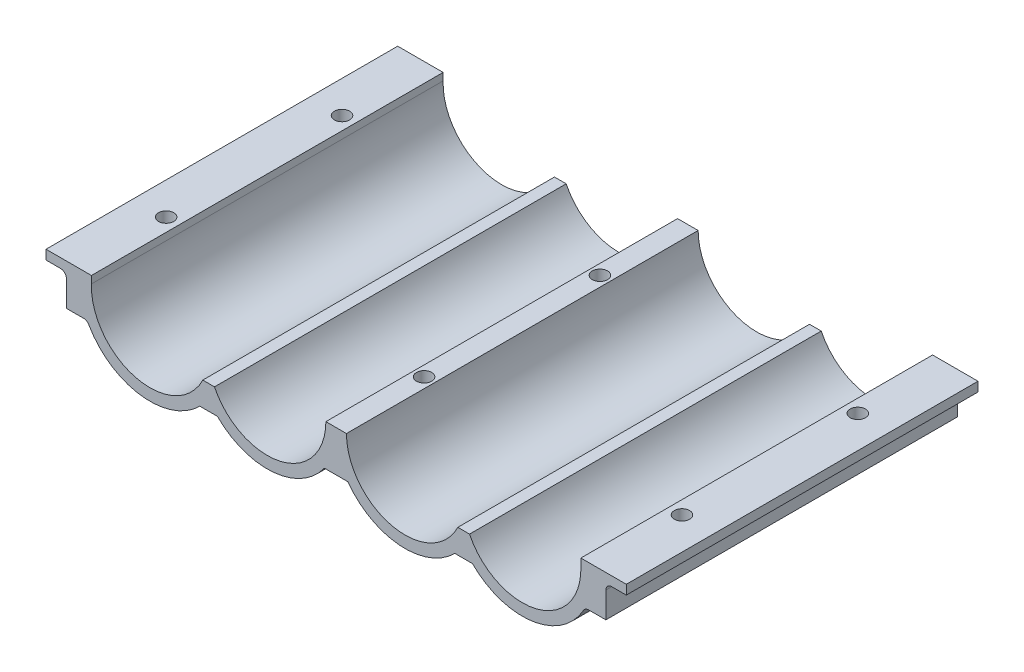
from build123d import *

# Parameters (mm, degrees)
BOSS_EXTRUDE1_DEPTH                  = 60
FILLET1_R                            = 1
F_2_6_START                          = -7
F_2_6_2_6_DIAMETER_HOLE1_OUTLINE_R   = 1.3
F_2_6_2_6_DIAMETER_HOLE1_DEPTH       = 7
F_2_6_START_2                        = -8.6
F_2_6_2_6_DIAMETER_HOLE1_2_OUTLINE_R = 1.3
F_2_6_2_6_DIAMETER_HOLE1_2_DEPTH     = 1.6


# Read off the part's stored shape, not the designer's step: Ø2.6 (2.6) Diameter Hole1
with BuildPart() as part:
    # Sketch1 → Boss-Extrude1 (new body)
    with BuildSketch(Plane.XY):
        with BuildLine():
            Line((0, 0), (7.751531367, 0))
            Line((7.751531367, 0), (7.751531367, -1.25))
            ThreePointArc((7.751531367, -1.25), (15.339084008, -11.30616411), (26.74540449, -5.958898944))
            Line((26.74540449, -5.958898944), (28.74540449, -5.958898944))
            ThreePointArc((28.74540449, -5.958898944), (39.981472468, -11.346794345), (47.74540449, -1.6))
            Line((47.74540449, -1.6), (51.25459551, -1.6))
            ThreePointArc((51.25459551, -1.6), (59.018527532, -11.346794345), (70.25459551, -5.958898944))
            Line((70.25459551, -5.958898944), (72.25459551, -5.958898944))
            ThreePointArc((72.25459551, -5.958898944), (83.660915992, -11.30616411), (91.248468633, -1.25))
            Line((91.248468633, -1.25), (91.248468633, 0))
            Line((91.248468633, 0), (99, 0))
            Line((99, 0), (99, -1.6))
            Line((99, -1.6), (95.52, -1.6))
            Line((95.52, -1.6), (95.52, -7))
            Line((95.52, -7), (91.970938169, -7))
            ThreePointArc((91.970938169, -7), (83.148029778, -13.449679602), (72.75459551, -10.070537173))
            Line((72.75459551, -10.070537173), (69.75459551, -10.070537173))
            ThreePointArc((69.75459551, -10.070537173), (60.290622518, -13.561218837), (51.507801165, -8.6))
            Line((51.507801165, -8.6), (47.492198835, -8.6))
            ThreePointArc((47.492198835, -8.6), (38.709377482, -13.561218837), (29.24540449, -10.070537173))
            Line((29.24540449, -10.070537173), (26.24540449, -10.070537173))
            ThreePointArc((26.24540449, -10.070537173), (15.851970222, -13.449679602), (7.029061831, -7))
            Line((7.029061831, -7), (3.48, -7))
            Line((3.48, -7), (3.48, -1.6))
            Line((3.48, -1.6), (0, -1.6))
            Line((0, -1.6), (0, 0))
        make_face()
    extrude(amount=BOSS_EXTRUDE1_DEPTH)

    # Fillet1
    fillet1_edges = [part.edges().sort_by_distance(p)[0] for p in [
        (95.52, -1.6, 30),
        (91.970938169, -7, 30),
        (7.029061831, -7, 30),
        (3.48, -1.6, 30),
    ]]
    fillet(fillet1_edges, radius=FILLET1_R)

    # Ø2.6 (2.6) Diameter Hole1 outline → Ø2.6 (2.6) Diameter Hole1 (cut)
    with BuildSketch(Plane(origin=(0, 0, 0), x_dir=(1, 0, 0), z_dir=(0, 1, 0)).offset(F_2_6_START)):
        with Locations((93.5, -15)):
            Circle(F_2_6_2_6_DIAMETER_HOLE1_OUTLINE_R)
        with Locations((93.5, -45)):
            Circle(F_2_6_2_6_DIAMETER_HOLE1_OUTLINE_R)
        with Locations((49.5, -15)):
            Circle(F_2_6_2_6_DIAMETER_HOLE1_OUTLINE_R)
        with Locations((49.5, -45)):
            Circle(F_2_6_2_6_DIAMETER_HOLE1_OUTLINE_R)
    f_2_6_2_6_diameter_hole1 = extrude(amount=F_2_6_2_6_DIAMETER_HOLE1_DEPTH, mode=Mode.SUBTRACT)

    # 2.6 _2.6_ Diameter Hole1 2 outline → 2.6 _2.6_ Diameter Hole1 2 (cut)
    with BuildSketch(Plane(origin=(0, 0, 0), x_dir=(1, 0, 0), z_dir=(0, 1, 0)).offset(F_2_6_START_2)):
        with Locations((49.5, -15)):
            Circle(F_2_6_2_6_DIAMETER_HOLE1_2_OUTLINE_R)
        with Locations((49.5, -45)):
            Circle(F_2_6_2_6_DIAMETER_HOLE1_2_OUTLINE_R)
    f_2_6_2_6_diameter_hole1_2 = extrude(amount=F_2_6_2_6_DIAMETER_HOLE1_2_DEPTH, mode=Mode.SUBTRACT)

    # Mirror1: Ø2.6 (2.6) Diameter Hole1, 2.6 _2.6_ Diameter Hole1 2 across plane
    add(f_2_6_2_6_diameter_hole1.mirror(Plane.ZY.offset(-49.5)), mode=Mode.SUBTRACT)
    add(f_2_6_2_6_diameter_hole1_2.mirror(Plane.ZY.offset(-49.5)), mode=Mode.SUBTRACT)


solid = part.part
